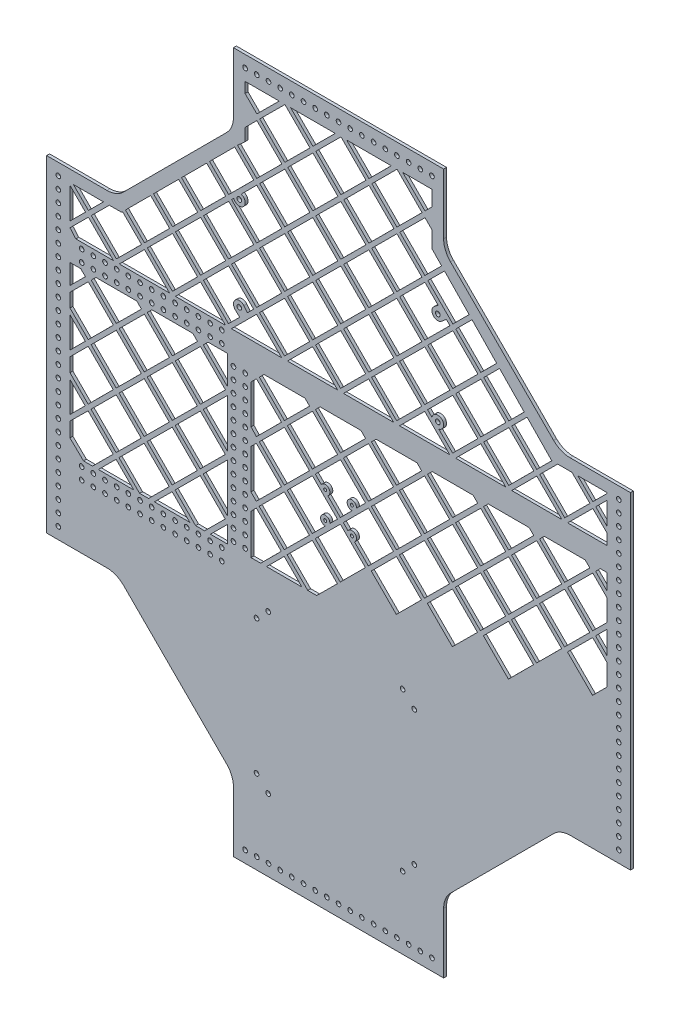
from build123d import *

# Parameters (mm, degrees)
BOSS_EXTRUDE1_DEPTH = 3.175
SKETCH2_R           = 2.54
CUT_EXTRUDE2_DEPTH  = 3.175
SKETCH3_R           = 1.651
CUT_EXTRUDE3_DEPTH  = 3.175
SKETCH4_R           = 2.54
CUT_EXTRUDE5_DEPTH  = 3.175
SKETCH5_R           = 2.54
CUT_EXTRUDE7_DEPTH  = 3.175
FILLET1_R           = 25.4
FILLET2_R           = 25.4
FILLET3_R           = 25.4
FILLET4_R           = 25.4
FILLET5_R           = 25.4
CUT_EXTRUDE8_DEPTH  = 3.175


with BuildPart() as part:
    # Sketch1 → Boss-Extrude1 (new body)
    with BuildSketch(Plane.XY):
        Polygon((-241.3, 177.8), (-317.5, 177.8), (-317.5, -177.8), (-241.3, -177.8), (-114.3, -304.8), (-114.3, -381), (114.3, -381), (114.3, -304.8), (241.3, -177.8), (317.5, -177.8), (317.5, 177.8), (241.3, 177.8), (114.3, 304.8), (114.3, 381), (-114.3, 381), (-114.3, 304.8), align=None)
    extrude(amount=BOSS_EXTRUDE1_DEPTH)

    # Sketch2 → Cut-Extrude2 (cut)
    with BuildSketch(Plane.XY.offset(3.175)):
        with Locations((-304.8, 165.1)):
            Circle(SKETCH2_R)
        with Locations((-304.8, 152.4)):
            Circle(SKETCH2_R)
        with Locations((-304.8, 139.7)):
            Circle(SKETCH2_R)
        with Locations((-304.8, 127)):
            Circle(SKETCH2_R)
        with Locations((-304.8, 114.3)):
            Circle(SKETCH2_R)
        with Locations((-304.8, 101.6)):
            Circle(SKETCH2_R)
        with Locations((-304.8, 88.9)):
            Circle(SKETCH2_R)
        with Locations((-304.8, 76.2)):
            Circle(SKETCH2_R)
        with Locations((-304.8, 63.5)):
            Circle(SKETCH2_R)
        with Locations((-304.8, 50.8)):
            Circle(SKETCH2_R)
        with Locations((-304.8, 38.1)):
            Circle(SKETCH2_R)
        with Locations((-304.8, 25.4)):
            Circle(SKETCH2_R)
        with Locations((-304.8, 12.7)):
            Circle(SKETCH2_R)
        with Locations((-304.8, 0)):
            Circle(SKETCH2_R)
        with Locations((-304.8, -12.7)):
            Circle(SKETCH2_R)
        with Locations((-304.8, -25.4)):
            Circle(SKETCH2_R)
        with Locations((-304.8, -38.1)):
            Circle(SKETCH2_R)
        with Locations((-304.8, -50.8)):
            Circle(SKETCH2_R)
        with Locations((-304.8, -63.5)):
            Circle(SKETCH2_R)
        with Locations((-304.8, -76.2)):
            Circle(SKETCH2_R)
        with Locations((-304.8, -88.9)):
            Circle(SKETCH2_R)
        with Locations((-304.8, -101.6)):
            Circle(SKETCH2_R)
        with Locations((-304.8, -114.3)):
            Circle(SKETCH2_R)
        with Locations((-304.8, -127)):
            Circle(SKETCH2_R)
        with Locations((-304.8, -139.7)):
            Circle(SKETCH2_R)
        with Locations((-304.8, -152.4)):
            Circle(SKETCH2_R)
        with Locations((-304.8, -165.1)):
            Circle(SKETCH2_R)
        with Locations(Location((304.8, -165.1, 0), (0, 0, 180))):
            Circle(SKETCH2_R)
        with Locations(Location((304.8, -152.4, 0), (0, 0, 180))):
            Circle(SKETCH2_R)
        with Locations(Location((304.8, -139.7, 0), (0, 0, 180))):
            Circle(SKETCH2_R)
        with Locations(Location((304.8, -127, 0), (0, 0, 180))):
            Circle(SKETCH2_R)
        with Locations(Location((304.8, -114.3, 0), (0, 0, 180))):
            Circle(SKETCH2_R)
        with Locations(Location((304.8, -101.6, 0), (0, 0, 180))):
            Circle(SKETCH2_R)
        with Locations(Location((304.8, -88.9, 0), (0, 0, 180))):
            Circle(SKETCH2_R)
        with Locations(Location((304.8, -76.2, 0), (0, 0, 180))):
            Circle(SKETCH2_R)
        with Locations(Location((304.8, -63.5, 0), (0, 0, 180))):
            Circle(SKETCH2_R)
        with Locations(Location((304.8, -50.8, 0), (0, 0, 180))):
            Circle(SKETCH2_R)
        with Locations(Location((304.8, -38.1, 0), (0, 0, 180))):
            Circle(SKETCH2_R)
        with Locations(Location((304.8, -25.4, 0), (0, 0, 180))):
            Circle(SKETCH2_R)
        with Locations(Location((304.8, -12.7, 0), (0, 0, 180))):
            Circle(SKETCH2_R)
        with Locations(Location((304.8, 0, 0), (0, 0, 180))):
            Circle(SKETCH2_R)
        with Locations(Location((304.8, 12.7, 0), (0, 0, 180))):
            Circle(SKETCH2_R)
        with Locations(Location((304.8, 25.4, 0), (0, 0, 180))):
            Circle(SKETCH2_R)
        with Locations(Location((304.8, 38.1, 0), (0, 0, 180))):
            Circle(SKETCH2_R)
        with Locations(Location((304.8, 50.8, 0), (0, 0, 180))):
            Circle(SKETCH2_R)
        with Locations(Location((304.8, 63.5, 0), (0, 0, 180))):
            Circle(SKETCH2_R)
        with Locations(Location((304.8, 76.2, 0), (0, 0, 180))):
            Circle(SKETCH2_R)
        with Locations(Location((304.8, 88.9, 0), (0, 0, 180))):
            Circle(SKETCH2_R)
        with Locations(Location((304.8, 101.6, 0), (0, 0, 180))):
            Circle(SKETCH2_R)
        with Locations(Location((304.8, 114.3, 0), (0, 0, 180))):
            Circle(SKETCH2_R)
        with Locations(Location((304.8, 127, 0), (0, 0, 180))):
            Circle(SKETCH2_R)
        with Locations(Location((304.8, 139.7, 0), (0, 0, 180))):
            Circle(SKETCH2_R)
        with Locations(Location((304.8, 152.4, 0), (0, 0, 180))):
            Circle(SKETCH2_R)
        with Locations(Location((304.8, 165.1, 0), (0, 0, 180))):
            Circle(SKETCH2_R)
        with Locations((-101.6, -368.3)):
            Circle(SKETCH2_R)
        with Locations((-88.9, -368.3)):
            Circle(SKETCH2_R)
        with Locations((-76.2, -368.3)):
            Circle(SKETCH2_R)
        with Locations((-63.5, -368.3)):
            Circle(SKETCH2_R)
        with Locations((-50.8, -368.3)):
            Circle(SKETCH2_R)
        with Locations((-38.1, -368.3)):
            Circle(SKETCH2_R)
        with Locations((-25.4, -368.3)):
            Circle(SKETCH2_R)
        with Locations((-12.7, -368.3)):
            Circle(SKETCH2_R)
        with Locations((0, -368.3)):
            Circle(SKETCH2_R)
        with Locations((12.7, -368.3)):
            Circle(SKETCH2_R)
        with Locations((25.4, -368.3)):
            Circle(SKETCH2_R)
        with Locations((38.1, -368.3)):
            Circle(SKETCH2_R)
        with Locations((50.8, -368.3)):
            Circle(SKETCH2_R)
        with Locations((63.5, -368.3)):
            Circle(SKETCH2_R)
        with Locations((76.2, -368.3)):
            Circle(SKETCH2_R)
        with Locations((88.9, -368.3)):
            Circle(SKETCH2_R)
        with Locations((101.6, -368.3)):
            Circle(SKETCH2_R)
        with Locations(Location((101.6, 368.3, 0), (0, 0, 180))):
            Circle(SKETCH2_R)
        with Locations(Location((88.9, 368.3, 0), (0, 0, 180))):
            Circle(SKETCH2_R)
        with Locations(Location((76.2, 368.3, 0), (0, 0, 180))):
            Circle(SKETCH2_R)
        with Locations(Location((63.5, 368.3, 0), (0, 0, 180))):
            Circle(SKETCH2_R)
        with Locations(Location((50.8, 368.3, 0), (0, 0, 180))):
            Circle(SKETCH2_R)
        with Locations(Location((38.1, 368.3, 0), (0, 0, 180))):
            Circle(SKETCH2_R)
        with Locations(Location((25.4, 368.3, 0), (0, 0, 180))):
            Circle(SKETCH2_R)
        with Locations(Location((12.7, 368.3, 0), (0, 0, 180))):
            Circle(SKETCH2_R)
        with Locations(Location((0, 368.3, 0), (0, 0, 180))):
            Circle(SKETCH2_R)
        with Locations(Location((-12.7, 368.3, 0), (0, 0, 180))):
            Circle(SKETCH2_R)
        with Locations(Location((-25.4, 368.3, 0), (0, 0, 180))):
            Circle(SKETCH2_R)
        with Locations(Location((-38.1, 368.3, 0), (0, 0, 180))):
            Circle(SKETCH2_R)
        with Locations(Location((-50.8, 368.3, 0), (0, 0, 180))):
            Circle(SKETCH2_R)
        with Locations(Location((-63.5, 368.3, 0), (0, 0, 180))):
            Circle(SKETCH2_R)
        with Locations(Location((-76.2, 368.3, 0), (0, 0, 180))):
            Circle(SKETCH2_R)
        with Locations(Location((-88.9, 368.3, 0), (0, 0, 180))):
            Circle(SKETCH2_R)
        with Locations(Location((-101.6, 368.3, 0), (0, 0, 180))):
            Circle(SKETCH2_R)
    extrude(amount=-CUT_EXTRUDE2_DEPTH, mode=Mode.SUBTRACT)

    # Sketch3 → Cut-Extrude3 (cut)
    with BuildSketch(Plane.XY.offset(3.175)):
        with BuildLine():
            ThreePointArc((110.49, 241.3), (107.95, 243.84), (105.41, 241.3))
            Line((105.41, 241.3), (107.95, 241.3))
            Line((107.95, 241.3), (107.95, 238.76))
            ThreePointArc((107.95, 238.76), (109.746051224, 239.503948776), (110.49, 241.3))
        make_face()
        with BuildLine():
            Line((107.95, 241.3), (105.41, 241.3))
            ThreePointArc((105.41, 241.3), (106.153948776, 239.503948776), (107.95, 238.76))
            Line((107.95, 238.76), (107.95, 241.3))
        make_face()
        with BuildLine():
            ThreePointArc((-105.41, 139.7), (-106.153948776, 141.496051224), (-107.95, 142.24))
            Line((-107.95, 142.24), (-107.95, 139.7))
            Line((-107.95, 139.7), (-105.41, 139.7))
        make_face()
        with BuildLine():
            Line((-107.95, 139.7), (-107.95, 142.24))
            ThreePointArc((-107.95, 142.24), (-109.746051224, 137.903948776), (-105.41, 139.7))
            Line((-105.41, 139.7), (-107.95, 139.7))
        make_face()
        with BuildLine():
            Line((-107.95, 238.76), (-107.95, 241.3))
            Line((-107.95, 241.3), (-105.41, 241.3))
            ThreePointArc((-105.41, 241.3), (-109.746051224, 243.096051224), (-107.95, 238.76))
        make_face()
        with BuildLine():
            Line((-105.41, 241.3), (-107.95, 241.3))
            Line((-107.95, 241.3), (-107.95, 238.76))
            ThreePointArc((-107.95, 238.76), (-106.153948776, 239.503948776), (-105.41, 241.3))
        make_face()
        with BuildLine():
            ThreePointArc((110.49, 139.7), (109.746051224, 141.496051224), (107.95, 142.24))
            Line((107.95, 142.24), (107.95, 139.7))
            Line((107.95, 139.7), (105.41, 139.7))
            ThreePointArc((105.41, 139.7), (107.95, 137.16), (110.49, 139.7))
        make_face()
        with BuildLine():
            Line((107.95, 139.7), (107.95, 142.24))
            ThreePointArc((107.95, 142.24), (106.153948776, 141.496051224), (105.41, 139.7))
            Line((105.41, 139.7), (107.95, 139.7))
        make_face()
        with Locations((-14.478, 14.478)):
            Circle(SKETCH3_R)
        with Locations((14.478, 14.478)):
            Circle(SKETCH3_R)
        with Locations((14.478, -14.478)):
            Circle(SKETCH3_R)
        with Locations((-14.478, -14.478)):
            Circle(SKETCH3_R)
    extrude(amount=-CUT_EXTRUDE3_DEPTH, mode=Mode.SUBTRACT)

    # Sketch4 → Cut-Extrude5 (cut)
    with BuildSketch(Plane.XY.offset(3.175)):
        with Locations((-279.4, 96.139)):
            Circle(SKETCH4_R)
        with Locations((-266.7, 96.139)):
            Circle(SKETCH4_R)
        with Locations((-254, 96.139)):
            Circle(SKETCH4_R)
        with Locations((-241.3, 96.139)):
            Circle(SKETCH4_R)
        with Locations((-228.6, 96.139)):
            Circle(SKETCH4_R)
        with Locations((-215.9, 96.139)):
            Circle(SKETCH4_R)
        with Locations((-203.2, 96.139)):
            Circle(SKETCH4_R)
        with Locations((-190.5, 96.139)):
            Circle(SKETCH4_R)
        with Locations((-177.8, 96.139)):
            Circle(SKETCH4_R)
        with Locations((-165.1, 96.139)):
            Circle(SKETCH4_R)
        with Locations((-152.4, 96.139)):
            Circle(SKETCH4_R)
        with Locations((-139.7, 96.139)):
            Circle(SKETCH4_R)
        with Locations((-127, 96.139)):
            Circle(SKETCH4_R)
        with Locations((-127, -96.139)):
            Circle(SKETCH4_R)
        with Locations((-139.7, -96.139)):
            Circle(SKETCH4_R)
        with Locations((-152.4, -96.139)):
            Circle(SKETCH4_R)
        with Locations((-165.1, -96.139)):
            Circle(SKETCH4_R)
        with Locations((-177.8, -96.139)):
            Circle(SKETCH4_R)
        with Locations((-190.5, -96.139)):
            Circle(SKETCH4_R)
        with Locations((-203.2, -96.139)):
            Circle(SKETCH4_R)
        with Locations((-215.9, -96.139)):
            Circle(SKETCH4_R)
        with Locations((-228.6, -96.139)):
            Circle(SKETCH4_R)
        with Locations((-241.3, -96.139)):
            Circle(SKETCH4_R)
        with Locations((-254, -96.139)):
            Circle(SKETCH4_R)
        with Locations((-266.7, -96.139)):
            Circle(SKETCH4_R)
        with Locations(Location((-279.4, -96.139, 0), (0, 0, 180))):
            Circle(SKETCH4_R)
        with Locations((-279.4, -108.839)):
            Circle(SKETCH4_R)
        with Locations((-279.4, 108.839)):
            Circle(SKETCH4_R)
        with Locations((-266.7, 108.839)):
            Circle(SKETCH4_R)
        with Locations((-254, 108.839)):
            Circle(SKETCH4_R)
        with Locations((-241.3, 108.839)):
            Circle(SKETCH4_R)
        with Locations((-228.6, 108.839)):
            Circle(SKETCH4_R)
        with Locations((-215.9, 108.839)):
            Circle(SKETCH4_R)
        with Locations((-203.2, 108.839)):
            Circle(SKETCH4_R)
        with Locations((-190.5, 108.839)):
            Circle(SKETCH4_R)
        with Locations((-177.8, 108.839)):
            Circle(SKETCH4_R)
        with Locations((-165.1, 108.839)):
            Circle(SKETCH4_R)
        with Locations((-152.4, 108.839)):
            Circle(SKETCH4_R)
        with Locations((-139.7, 108.839)):
            Circle(SKETCH4_R)
        with Locations((-127, 108.839)):
            Circle(SKETCH4_R)
        with Locations((-127, -108.839)):
            Circle(SKETCH4_R)
        with Locations((-139.7, -108.839)):
            Circle(SKETCH4_R)
        with Locations((-152.4, -108.839)):
            Circle(SKETCH4_R)
        with Locations((-165.1, -108.839)):
            Circle(SKETCH4_R)
        with Locations((-177.8, -108.839)):
            Circle(SKETCH4_R)
        with Locations((-190.5, -108.839)):
            Circle(SKETCH4_R)
        with Locations((-203.2, -108.839)):
            Circle(SKETCH4_R)
        with Locations((-215.9, -108.839)):
            Circle(SKETCH4_R)
        with Locations((-228.6, -108.839)):
            Circle(SKETCH4_R)
        with Locations((-241.3, -108.839)):
            Circle(SKETCH4_R)
        with Locations((-254, -108.839)):
            Circle(SKETCH4_R)
        with Locations((-266.7, -108.839)):
            Circle(SKETCH4_R)
        with Locations((-114.3, 80.899)):
            Circle(SKETCH4_R)
        with Locations((-114.3, 68.199)):
            Circle(SKETCH4_R)
        with Locations((-101.6, -84.201)):
            Circle(SKETCH4_R)
        with Locations((-101.6, -71.501)):
            Circle(SKETCH4_R)
        with Locations((-101.6, -58.801)):
            Circle(SKETCH4_R)
        with Locations((-101.6, -46.101)):
            Circle(SKETCH4_R)
        with Locations((-101.6, -33.401)):
            Circle(SKETCH4_R)
        with Locations((-101.6, -20.701)):
            Circle(SKETCH4_R)
        with Locations((-101.6, -8.001)):
            Circle(SKETCH4_R)
        with Locations((-101.6, 4.699)):
            Circle(SKETCH4_R)
        with Locations((-101.6, 17.399)):
            Circle(SKETCH4_R)
        with Locations((-101.6, 30.099)):
            Circle(SKETCH4_R)
        with Locations((-101.6, 42.799)):
            Circle(SKETCH4_R)
        with Locations((-101.6, 55.499)):
            Circle(SKETCH4_R)
        with Locations((-101.6, 68.199)):
            Circle(SKETCH4_R)
        with Locations((-101.6, 80.899)):
            Circle(SKETCH4_R)
        with Locations((-114.3, 55.499)):
            Circle(SKETCH4_R)
        with Locations((-114.3, 42.799)):
            Circle(SKETCH4_R)
        with Locations((-114.3, 30.099)):
            Circle(SKETCH4_R)
        with Locations((-114.3, 17.399)):
            Circle(SKETCH4_R)
        with Locations((-114.3, 4.699)):
            Circle(SKETCH4_R)
        with Locations((-114.3, -8.001)):
            Circle(SKETCH4_R)
        with Locations((-114.3, -20.701)):
            Circle(SKETCH4_R)
        with Locations((-114.3, -33.401)):
            Circle(SKETCH4_R)
        with Locations((-114.3, -46.101)):
            Circle(SKETCH4_R)
        with Locations((-114.3, -58.801)):
            Circle(SKETCH4_R)
        with Locations((-114.3, -71.501)):
            Circle(SKETCH4_R)
        with Locations((-114.3, -84.201)):
            Circle(SKETCH4_R)
    extrude(amount=-CUT_EXTRUDE5_DEPTH, mode=Mode.SUBTRACT)

    # Sketch5 → Cut-Extrude7 (cut)
    with BuildSketch(Plane.XY.offset(3.175)):
        with Locations((-76.492754683, -131.119022234)):
            Circle(SKETCH5_R)
        with Locations((-89.192754683, -143.819022234)):
            Circle(SKETCH5_R)
        with Locations((69.658845317, -131.119022234)):
            Circle(SKETCH5_R)
        with Locations((82.358845317, -143.819022234)):
            Circle(SKETCH5_R)
        with Locations((82.358845317, -289.970622234)):
            Circle(SKETCH5_R)
        with Locations((69.658845317, -302.670622234)):
            Circle(SKETCH5_R)
        with Locations((-76.492754683, -302.670622234)):
            Circle(SKETCH5_R)
        with Locations((-89.192754683, -289.970622234)):
            Circle(SKETCH5_R)
    extrude(amount=-CUT_EXTRUDE7_DEPTH, mode=Mode.SUBTRACT)

    # Fillet1
    fillet1_edges = [part.edges().sort_by_distance(p)[0] for p in [
        (-241.3, -177.8, 1.5875),
    ]]
    fillet(fillet1_edges, radius=FILLET1_R)

    # Fillet2
    fillet2_edges = [part.edges().sort_by_distance(p)[0] for p in [
        (-114.3, -304.8, 1.5875),
    ]]
    fillet(fillet2_edges, radius=FILLET2_R)

    # Fillet3
    fillet3_edges = [part.edges().sort_by_distance(p)[0] for p in [
        (241.3, -177.8, 1.5875),
        (114.3, -304.8, 1.5875),
    ]]
    fillet(fillet3_edges, radius=FILLET3_R)

    # Fillet4
    fillet4_edges = [part.edges().sort_by_distance(p)[0] for p in [
        (114.3, 304.8, 1.5875),
        (241.3, 177.8, 1.5875),
    ]]
    fillet(fillet4_edges, radius=FILLET4_R)

    # Fillet5
    fillet5_edges = [part.edges().sort_by_distance(p)[0] for p in [
        (-241.3, 177.8, 1.5875),
        (-114.3, 304.8, 1.5875),
    ]]
    fillet(fillet5_edges, radius=FILLET5_R)

    # Sketch7 → Cut-Extrude8 (cut)
    with BuildSketch(Plane.XY.offset(3.175)):
        Polygon((-101.59999581, 355.599999541), (-101.599995759, 344.118921685), (-88.848381929, 331.366300998), (-64.53226498, 355.599999706), align=None)
        Polygon((-288.368468294, 165.099999985), (-272.053430214, 148.782372197), (-255.680294272, 165.099999985), align=None)
        Polygon((112.137642561, 288.657627297), (101.600000003, 299.539487756), (101.6, 317.445709878), (94.020322736, 325.026590273), (66.668701578, 297.767696449), (93.9251715, 270.506900079), align=None)
        Polygon((-275.234073255, 145.612512161), (-292.100000049, 162.481116098), (-292.100000049, 128.803764179), align=None)
        Polygon((292.1, 164.243209402), (292.1, 165.1), (260.271531724, 165.1), (276.586569545, 148.782372476), align=None)
        Polygon((-173.934302338, 227.205185316), (-201.241468308, 199.898019302), (-180.55925666, 179.213028677), (-153.205726886, 206.473824657), align=None)
        Polygon((231.999705594, 165.1), (231.78686217, 165.1), (205.071542693, 192.687990109), (188.372008911, 176.045071024), (215.628478715, 148.784274772), align=None)
        Polygon((-95.250000011, -27.896529966), (-89.471550029, -33.774737828), (-62.144939159, -6.540769547), (-89.427628362, 20.746250258), (-95.250000011, 15.038671506), align=None)
        Polygon((292.1, 42.736541851), (292.1, 65.949607141), (276.468846375, 81.583241915), (249.113407278, 54.3205431), (276.369876966, 27.059746965), align=None)
        Polygon((-292.100000049, -20.427912633), (-292.100000049, -53.456236941), (-275.559112246, -36.971425978), align=None)
        Polygon((-292.100000049, 89.789), (-292.100000049, 68.050430478), (-275.342419575, 84.751199476), (-280.379420571, 89.789), align=None)
        Polygon((-292.100000049, 40.541763611), (-292.100000049, 7.28337636), (-275.443894613, 23.883014339), align=None)
        Polygon((292.1, 115.188999953), (292.1, 126.915471617), (276.575283475, 142.442652396), (249.223662342, 115.183758547), align=None)
        Polygon((-216.399920673, -89.788999976), (-206.636357392, -89.788999976), (-184.17328546, -67.402082261), (-211.429755315, -40.141285967), (-238.783285442, -67.402082286), align=None)
        Polygon((-261.24635733, -89.788999976), (-222.749920673, -89.788999976), (-241.963928479, -70.571942322), align=None)
        Polygon((-155.439920673, -89.788999976), (-145.676357534, -89.788999976), (-123.213285519, -67.402082195), (-150.469755318, -40.141285948), (-177.82328546, -67.402082261), align=None)
        Polygon((-200.286357392, -89.788999976), (-161.789920673, -89.788999976), (-181.003928499, -70.571942296), align=None)
        Polygon((-95.250000014, -89.788999976), (-84.716357247, -89.788999976), (-62.253285393, -67.402082323), (-89.46715496, -40.183893076), (-95.250000014, -46.103888996), align=None)
        Polygon((-33.519920672, -89.788999976), (-23.756357301, -89.788999976), (-1.293285439, -67.402082294), (-28.549755276, -40.141286017), (-55.903285393, -67.402082323), align=None)
        Polygon((-78.366357247, -89.788999976), (-39.869920672, -89.788999976), (-59.083928431, -70.57194236), align=None)
        Polygon((-150.458469239, -33.801565876), (-123.104939108, -6.540769574), (-150.361408986, 20.720026747), (-177.714939104, -6.540769564), align=None)
        Polygon((292.1, -18.016792038), (292.1, 4.976119129), (276.358590898, 20.720026882), (249.005060805, -6.540769473), (276.261530726, -33.801565842), align=None)
        Polygon((-95.250000058, 33.438695661), (-89.338546529, 27.111148315), (-62.036592793, 54.320543076), (-89.293062702, 81.581339415), (-95.250000058, 75.644597239), align=None)
        Polygon((-150.350122899, 27.059746832), (-122.996592801, 54.320543123), (-150.253062633, 81.581339395), (-177.606592726, 54.320543111), align=None)
        Polygon((-238.458246408, 115.181855821), (-183.841375114, 115.174983373), (-211.10471631, 142.4426521), align=None)
        Polygon((-285.750000086, 115.189000043), (-244.80824642, 115.181855809), (-272.064716295, 142.442652127), (-285.750007586, 128.803756716), (-292.100000082, 122.45376422), align=None)
        Polygon((-143.451882992, 257.687604713), (-170.758797843, 230.380689817), (-150.025083723, 209.64368482), (-122.671553695, 236.904481053), align=None)
        Polygon((-116.538246418, 115.181855764), (-61.928246496, 115.181855764), (-89.18471634, 142.442652036), align=None)
        Polygon((-277.359920672, -89.788999976), (-267.59635733, -89.788999976), (-245.133285442, -67.402082286), (-272.389755283, -40.141286014), (-292.100000049, -59.518217826), (-292.100000049, -75.505421222), align=None)
        Polygon((-150.036370034, 203.303964733), (-177.389899846, 176.043168739), (-150.133430054, 148.78237208), (-122.779900052, 176.043168323), align=None)
        Polygon((-55.578246388, 115.181855834), (-0.968246387, 115.181855834), (-28.224716269, 142.442652124), align=None)
        Polygon((5.381753613, 115.18185581), (59.991753627, 115.18185581), (32.735232298, 142.442600839), align=None)
        Polygon((-119.502196829, 233.734621116), (-146.855726896, 206.473824869), (-119.599257134, 179.213028246), (-92.24572687, 206.47382475), align=None)
        Polygon((-140.276631082, 260.862856629), (-119.490910663, 240.074341086), (-92.137667651, 267.334851276), (-112.96978407, 288.169703686), align=None)
        Polygon((66.341753626, 115.181855812), (120.951753614, 115.181855812), (93.69528377, 142.442652104), align=None)
        Polygon((127.301753614, 115.181855877), (181.911753548, 115.181855877), (154.655283722, 142.442652151), align=None)
        Polygon((188.261753437, 115.181856098), (242.875564489, 115.181856098), (215.617192584, 142.444554752), align=None)
        with BuildLine():
            Line((103.922309205, 246.209196238), (108.287895231, 249.790888596))
            Line((108.287895231, 249.790888596), (93.91388542, 264.167180009))
            Line((93.91388542, 264.167180009), (66.558446144, 236.904481035))
            Line((66.558446144, 236.904481035), (93.814915958, 209.643684651))
            Line((93.814915958, 209.643684651), (121.170355296, 236.906383685))
            Line((121.170355296, 236.906383685), (117.254425831, 240.82293473))
            Line((117.254425831, 240.82293473), (112.034395174, 236.437879382))
            ThreePointArc((112.034395174, 236.437879382), (103.064259307, 237.24388872), (103.922309205, 246.209196238))
        make_face()
        with BuildLine():
            ThreePointArc((-14.240895343, -19.552463655), (-18.063997976, -10.879803435), (-9.4043708, -14.732335874))
            Line((-9.4043708, -14.732335874), (-1.184939085, -6.540769638))
            Line((-1.184939085, -6.540769638), (-28.441409028, 20.720026735))
            Line((-28.441409028, 20.720026735), (-55.794939159, -6.540769547))
            Line((-55.794939159, -6.540769547), (-28.538469201, -33.801565944))
            Line((-28.538469201, -33.801565944), (-14.240895343, -19.552463655))
        make_face()
        with BuildLine():
            ThreePointArc((14.81958641, 9.409497388), (10.892002024, 18.076196565), (19.545313378, 14.119203219))
            Line((19.545313378, 14.119203219), (29.349234065, 23.889886699))
            Line((29.349234065, 23.889886699), (2.092764143, 51.15068305))
            Line((2.092764143, 51.15068305), (-25.260765988, 23.889886768))
            Line((-25.260765988, 23.889886768), (-18.689958468, 17.318036261))
            ThreePointArc((-18.689958468, 17.318036261), (-10.885612491, 18.069817379), (-11.638632288, 10.265590821))
            Line((-11.638632288, 10.265590821), (1.995703953, -3.370909602))
            Line((1.995703953, -3.370909602), (14.81958641, 9.409497388))
        make_face()
        Polygon((69.801764882, 355.600000305), (94.031609096, 331.366310063), (101.600000199, 338.909042808), (101.600000199, 355.600000447), align=None)
        Polygon((1.984417878, -9.710629674), (-25.369112239, -36.971425981), (1.887357597, -64.232222256), (29.240887706, -36.971425932), align=None)
        Polygon((-120.650000001, 58.324585843), (-120.650000001, 89.789000012), (-142.017481788, 89.789000012), (-147.072419559, 84.751199467), align=None)
        Polygon((33.062231773, 325.028492703), (5.706792637, 297.765793863), (32.963262536, 270.504997393), (60.318701786, 297.767696241), align=None)
        Polygon((-236.039487719, 165.09999996), (-249.330294217, 165.09999996), (-268.884073234, 145.612512171), (-241.627603372, 118.351715855), (-214.274073272, 145.612512136), (-234.898887547, 166.240600203), align=None)
        Polygon((-58.975582199, -9.710629581), (-86.329112333, -36.971425866), (-59.072642355, -64.232222287), (-31.719112239, -36.971425981), align=None)
        Polygon((279.649489413, 84.753101952), (292.101905884, 72.298708897), (292.1, 89.788999953), (284.702518169, 89.788999953), align=None)
        with BuildLine():
            Line((-113.962035147, 239.256000566), (-116.321553806, 236.904481137))
            Line((-116.321553806, 236.904481137), (-89.065083941, 209.643684684))
            Line((-89.065083941, 209.643684684), (-61.711783449, 236.904252195))
            Line((-61.711783449, 236.904252195), (-88.968304816, 264.164997261))
            Line((-88.968304816, 264.164997261), (-105.885595828, 247.305059176))
            ThreePointArc((-105.885595828, 247.305059176), (-103.467502515, 236.802254277), (-113.962035147, 239.256000566))
        make_face()
        Polygon((279.75592651, 145.612512436), (292.1, 133.266479559), (292.1, 157.91473713), align=None)
        Polygon((-120.649999997, -71.175958966), (-139.326357534, -89.788999976), (-120.64999999, -89.788999976), align=None)
        Polygon((-147.289112279, -36.971425912), (-120.65, -63.614766645), (-120.650000019, -10.422625465), align=None)
        with BuildLine():
            Line((32.518591028, 20.720026664), (5.165060915, -6.540769638))
            Line((5.165060915, -6.540769638), (10.264191412, -11.640709522))
            ThreePointArc((10.264191412, -11.640709522), (18.070387507, -10.886182623), (17.314621636, -18.692258863))
            Line((17.314621636, -18.692258863), (32.421530741, -33.801565895))
            Line((32.421530741, -33.801565895), (59.775060842, -6.540769578))
            Line((59.775060842, -6.540769578), (32.518591028, 20.720026664))
        make_face()
        Polygon((-58.855949754, 57.490403111), (-31.502419635, 84.751199402), (-36.539420773, 89.789000064), (-81.057481825, 89.789000064), (-86.112419665, 84.751199451), align=None)
        Polygon((279.539233932, 23.889886923), (292.1, 11.327127071), (292.1, 36.408069575), align=None)
        Polygon((-58.867235831, 51.150683041), (-86.220765947, 23.889886755), (-58.964296119, -3.370909512), (-31.610765988, 23.889886768), align=None)
        Polygon((-150.144716309, 142.442652052), (-177.498246444, 115.181855742), (-122.888246452, 115.181855742), (-136.711222346, 129.007025774), (-136.711509404, 129.007312898), align=None)
        Polygon((-58.542420511, 233.734398129), (-85.895727027, 206.473824679), (-58.639257315, 179.213028378), (-31.285899214, 206.473653132), align=None)
        Polygon((-109.794528911, 291.344940463), (-88.957030624, 270.504705324), (-61.603207296, 297.765793862), (-88.859670613, 325.026583626), (-101.599990821, 312.32945036), (-101.599990821, 298.821281728), align=None)
        Polygon((-58.433850406, 294.595933896), (-85.787667759, 267.334851336), (-58.531146376, 240.074106294), (-31.177380534, 267.335137577), align=None)
        Polygon((-31.069034138, 328.196450226), (-58.325503725, 355.457246261), (-85.679028237, 328.196444308), (-58.42256423, 300.935653928), align=None)
        Polygon((5.273407182, 54.320543083), (32.529877102, 27.059746735), (59.883407335, 54.320543157), (32.626937424, 81.581339475), align=None)
        Polygon((-292.100000049, 46.89176361), (-272.263251574, 27.052874375), (-244.909721422, 54.313670709), (-272.173062614, 81.581339439), (-292.100000049, 61.721958221), align=None)
        Polygon((-241.74036446, 51.143810672), (-269.093894612, 23.883014339), (-241.844296039, -3.370909582), (-214.490765896, 23.889886751), align=None)
        Polygon((-263.937481804, 89.789000019), (-268.992419575, 84.751199475), (-241.729078383, 57.483530745), (-214.375548264, 84.744327045), (-219.419420599, 89.788999998), align=None)
        Polygon((-180.574029957, 172.869833452), (-207.924073235, 145.612512173), (-180.667603013, 118.351715874), (-153.315393049, 145.611196555), align=None)
        Polygon((-272.378469209, -33.801565942), (-245.024939077, -6.540769619), (-272.274537651, 20.713154303), (-292.100000049, 0.954904102), (-292.100000049, -14.077912633), align=None)
        Polygon((-211.321408934, 20.720026714), (-238.674939077, -6.540769619), (-211.41846924, -33.801565894), (-184.064939104, -6.540769564), align=None)
        Polygon((-241.855582114, -9.710629655), (-269.209112246, -36.971425978), (-241.952642404, -64.23222225), (-214.599112278, -36.97142593), align=None)
        Polygon((-238.559721422, 54.313670708), (-211.310122858, 27.059746788), (-183.956592742, 54.320543095), (-211.206191303, 81.574467008), align=None)
        Polygon((-180.78723578, 51.150683058), (-208.140765896, 23.889886751), (-180.884296066, -3.370909527), (-153.530765948, 23.889886784), align=None)
        Polygon((-208.025548259, 84.74432705), (-180.775949709, 57.490403127), (-153.422419595, 84.751199432), (-158.459420606, 89.788999969), (-202.963714713, 89.78899999), align=None)
        Polygon((-20.097481793, 89.789000014), (-25.152419635, 84.751199402), (2.104050222, 57.490403117), (29.457580463, 84.751199507), (24.420579477, 89.789000014), align=None)
        Polygon((-147.180765937, 23.889886795), (-120.650000022, -2.64509038), (-120.650000042, 50.330708214), align=None)
        Polygon((-55.686592793, 54.320543076), (-28.430122949, 27.059746802), (-1.076592817, 54.320543083), (-28.333062673, 81.581339367), align=None)
        Polygon((96.767637897, 84.751256713), (124.024159132, 57.490511779), (151.377580335, 84.751199567), (146.34057942, 89.789000011), (101.822518227, 89.789000011), align=None)
        Polygon((93.489877143, 27.059746942), (120.843522079, 54.320657704), (93.587000843, 81.58140264), (66.233407335, 54.320543157), align=None)
        Polygon((40.862518203, 89.789000013), (35.807580463, 84.751199507), (63.064050371, 57.490403192), (90.417637897, 84.751256713), (85.38067513, 89.789000013), align=None)
        Polygon((162.782518054, 89.789000064), (157.727580335, 84.751199567), (184.984050092, 57.490403362), (212.337580186, 84.751199716), (207.300579366, 89.789000064), align=None)
        Polygon((223.742517747, 89.789000064), (218.687580186, 84.751199716), (245.944050316, 57.490403137), (273.299489413, 84.753101952), (268.264390529, 89.789000064), align=None)
        Polygon((154.546937299, 81.581339529), (127.193522079, 54.320657704), (154.450043322, 27.059912761), (181.803407058, 54.320543321), align=None)
        Polygon((63.052764299, 51.150683123), (35.699234065, 23.889886699), (62.955703877, -3.370909541), (90.309234109, 23.889886906), align=None)
        Polygon((62.944417806, -9.710629616), (35.590887705, -36.971425932), (62.84735757, -64.232222227), (90.20088765, -36.971425888), align=None)
        Polygon((93.478591075, 20.72002687), (66.125060842, -6.540769578), (93.381530683, -33.801565848), (120.735060904, -6.540769367), align=None)
        Polygon((123.904417872, -9.710629406), (96.55088765, -36.971425888), (123.807357632, -64.232222299), (151.160887901, -36.971425841), align=None)
        Polygon((96.659234109, 23.889886906), (123.915703936, -3.370909328), (151.269406272, 23.890058684), (124.012885026, 51.150803629), align=None)
        Polygon((154.438769222, 20.720204606), (127.085060904, -6.540769367), (154.341530937, -33.801565807), (181.695290731, -6.540540602), align=None)
        Polygon((184.972764024, 51.15068328), (157.619406272, 23.890058684), (184.875927785, -3.370686529), (212.229234111, 23.889886745), align=None)
        Polygon((215.398591072, 20.720026708), (188.045290731, -6.540540602), (215.301811962, -33.801285532), (242.655060805, -6.540769473), align=None)
        Polygon((184.864653676, -9.710394675), (157.510887901, -36.971425841), (184.767357732, -64.232222079), (212.121174912, -36.97113961), align=None)
        Polygon((188.153407058, 54.320543321), (215.409877149, 27.059746782), (242.763407278, 54.3205431), (215.506937152, 81.581339675), align=None)
        Polygon((245.93276424, 51.150683063), (218.579234111, 23.889886745), (245.835703839, -3.370909431), (273.189233932, 23.889886923), align=None)
        with BuildLine():
            Line((-146.964073228, 145.61251213), (-119.707603774, 118.351715809))
            Line((-119.707603774, 118.351715809), (-107.58634654, 130.431879561))
            Line((-107.58634654, 130.431879561), (-111.76106423, 134.620798523))
            ThreePointArc((-111.76106423, 134.620798523), (-112.51834618, 144.110522802), (-103.007870371, 143.687211174))
            Line((-103.007870371, 143.687211174), (-99.120585612, 138.868939868))
            Line((-99.120585612, 138.868939868), (-92.354073442, 145.612512211))
            Line((-92.354073442, 145.612512211), (-119.610543169, 172.873308366))
            Line((-119.610543169, 172.873308366), (-146.964073228, 145.61251213))
        make_face()
        Polygon((-89.07636995, 203.303964759), (-116.429900076, 176.043168457), (-89.173430411, 148.782372226), (-61.819900152, 176.043168555), align=None)
        Polygon((-58.650543119, 172.873308451), (-86.004073219, 145.612512157), (-58.74760335, 118.351715835), (-31.394073218, 145.612512143), align=None)
        Polygon((-28.116536268, 203.303799059), (-55.469900095, 176.043168474), (-28.213430196, 148.782372163), (-0.860014916, 176.043054008), align=None)
        Polygon((-55.361783432, 236.904252226), (-28.105262108, 209.643507243), (-0.751553649, 236.904481168), (-28.008023544, 264.165277511), align=None)
        Polygon((2.417803244, 233.7346212), (-24.935899237, 206.47365311), (2.320622139, 179.21290808), (29.674273144, 206.473824852), align=None)
        Polygon((-27.899677234, 325.026590247), (-55.253207366, 297.765793934), (-27.996737498, 270.504997618), (-0.643207396, 297.765793961), align=None)
        Polygon((-52.118234676, 355.599999761), (-27.888391072, 331.366310292), (-3.572264982, 355.599999978), align=None)
        Polygon((2.636404906, 355.459149093), (-24.719034191, 328.196450288), (2.537435829, 300.93565419), (29.89287471, 328.198352841), align=None)
        Polygon((8.845576404, 355.600000033), (33.073517745, 331.368212881), (57.387735014, 355.600000249), align=None)
        Polygon((63.594495978, 355.457246553), (36.242874811, 328.198352739), (63.499344831, 300.937556271), (90.850966051, 328.196450033), align=None)
        Polygon((246.054305377, 118.353618587), (273.40592651, 145.612512436), (253.921531724, 165.1), (238.349705667, 165.1), (218.797835635, 145.614414777), align=None)
        Polygon((185.092396216, 118.35171541), (212.44783563, 145.614414781), (185.191365871, 172.875210988), (157.835926386, 145.612511811), align=None)
        with BuildLine():
            Line((109.041921991, 133.444585837), (124.132396621, 118.351715881))
            Line((124.132396621, 118.351715881), (151.485926762, 145.612512187))
            Line((151.485926762, 145.612512187), (124.22945696, 172.873308436))
            Line((124.22945696, 172.873308436), (96.875926811, 145.612512139))
            Line((96.875926811, 145.612512139), (101.694759224, 140.792914827))
            ThreePointArc((101.694759224, 140.792914827), (112.440484378, 144.189771712), (109.041921991, 133.444585837))
        make_face()
        Polygon((127.410099694, 176.043168164), (154.666569432, 148.782371855), (182.02200891, 176.045071025), (154.765539119, 203.305867264), align=None)
        Polygon((157.94618216, 206.475727299), (185.20265195, 179.214931061), (201.952955439, 195.908447734), (175.133105137, 223.604383224), align=None)
        Polygon((127.520355296, 236.906383685), (154.776825198, 209.645587335), (172.014517885, 226.824840847), (145.19466746, 254.520776465), align=None)
        Polygon((124.240742808, 179.213028139), (151.596182111, 206.475727348), (124.339712257, 233.736523649), (96.984272911, 206.473824607), align=None)
        Polygon((93.706569852, 148.782372174), (121.0601, 176.043168471), (93.803630111, 203.303964809), (66.450099972, 176.043168501), align=None)
        Polygon((63.172390734, 118.351709933), (90.525926811, 145.612512138), (63.269456932, 172.873308465), (35.915869381, 145.612454939), align=None)
        Polygon((2.212396649, 118.351715835), (29.565869353, 145.612454912), (2.309348017, 172.873199946), (-25.044073247, 145.612512143), align=None)
        Polygon((5.489985075, 176.043054021), (32.746506433, 148.78230901), (60.100099971, 176.043168502), (32.843630097, 203.303964824), align=None)
        Polygon((5.598446282, 236.904481238), (32.854916184, 209.643684889), (60.208446319, 236.9044812), (32.951976408, 264.165277558), align=None)
        Polygon((63.377803275, 233.734621168), (36.024273137, 206.47382486), (63.280743011, 179.213028538), (90.63427315, 206.473824845), align=None)
        Polygon((124.350998336, 240.076243721), (142.076080207, 257.741234089), (115.256229815, 285.437169672), (97.094528459, 267.337040045), align=None)
        Polygon((36.132619345, 267.335137495), (63.389089195, 240.074341074), (90.744528461, 267.337040043), (63.48805854, 294.597836412), align=None)
        Polygon((-24.827380504, 267.335137548), (2.429089397, 240.074341199), (29.782619585, 267.335137457), (2.526149631, 294.595933859), align=None)
        Polygon((-204.421842145, 196.71764564), (-231.723887543, 169.415600242), (-211.09343019, 148.782372167), (-183.743638859, 176.039442354), align=None)
        Polygon((-208.249112278, -36.97142593), (-180.992642421, -64.232222226), (-153.639112279, -36.971425912), (-180.895582142, -9.710629601), align=None)
    extrude(amount=-CUT_EXTRUDE8_DEPTH, mode=Mode.SUBTRACT)


solid = part.part
